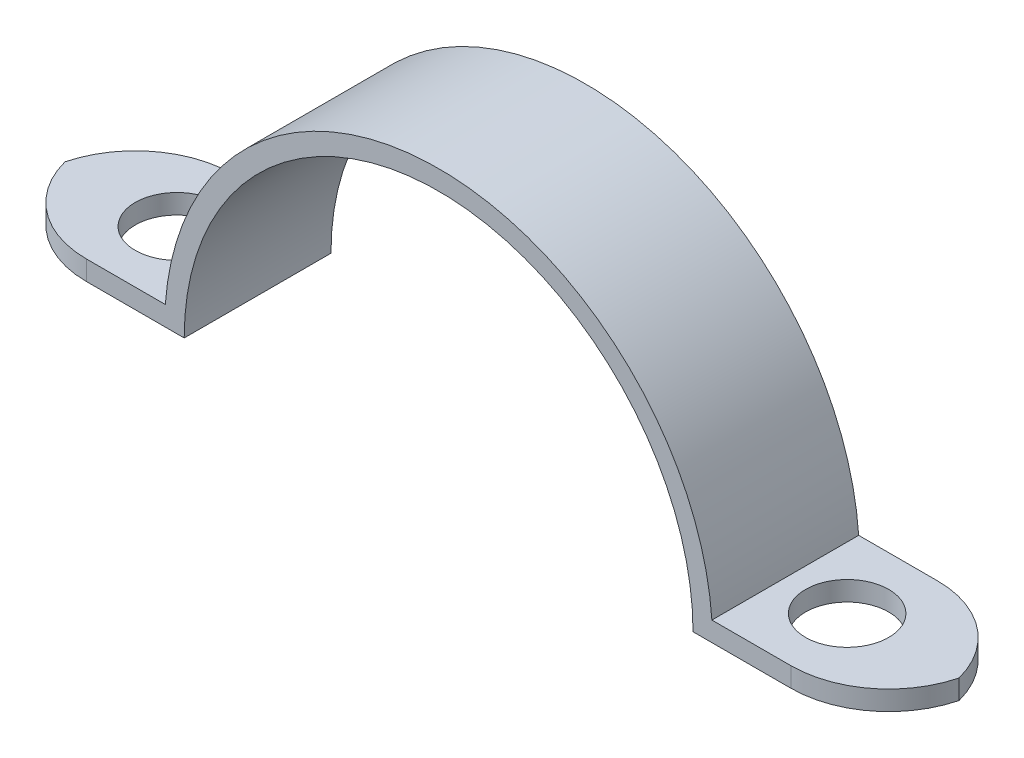
from build123d import *

# Parameters (mm, degrees)
EXTRUDE_THIN2_DEPTH = 15
SKETCH6_R           = 4.25
CUT_EXTRUDE1_DEPTH  = 55.927224579
FILLET1_R           = 10


with BuildPart() as part:
    # Sketch1 → Extrude-Thin2 (new body)
    with BuildSketch(Plane.XY):
        with BuildLine():
            Line((46, 0), (26, 0))
            ThreePointArc((26, 0), (0, 26), (-26, 0))
            Line((-26, 0), (-46, 0))
            Line((-46, 0), (-46, 2))
            Line((-46, 2), (-27.928480088, 2))
            ThreePointArc((-27.928480088, 2), (0, 28), (27.928480088, 2))
            Line((27.928480088, 2), (46, 2))
            Line((46, 2), (46, 0))
        make_face()
    extrude(amount=-EXTRUDE_THIN2_DEPTH)

    # Sketch6 → Cut-Extrude1 (cut, through all)
    with BuildSketch(Plane(origin=(0, 2, 0), x_dir=(1, 0, 0), z_dir=(0, 1, 0))):
        with Locations(Location((-34.25, 7.5, 0), (0, 0, 180))):
            Circle(SKETCH6_R)
        with Locations(Location((34.25, 7.5, 0), (0, 0, 180))):
            Circle(SKETCH6_R)
    extrude(amount=-CUT_EXTRUDE1_DEPTH, mode=Mode.SUBTRACT)

    # Fillet1
    # the kernel refuses this fillet: 10 mm, written as the material it takes off along each edge
    with BuildSketch(Plane(origin=(-46, -25, -15), x_dir=(1, 0, 0), z_dir=(0, 1, 0)), Plane(origin=(46, 27, -15), x_dir=(-1, 0, 0), z_dir=(0, -1, 0))) as fillet1_piece_1:
        with BuildLine():
            CenterArc((FILLET1_R, -FILLET1_R), FILLET1_R, 90, 90)
            Line((0, -FILLET1_R), (0, 0))
            Line((0, 0), (FILLET1_R, 0))
        make_face()
    extrude(amount=52, mode=Mode.SUBTRACT)
    with BuildSketch(Plane(origin=(-46, -25, 0), x_dir=(1, 0, 0), z_dir=(0, 1, 0)), Plane(origin=(46, 27, 0), x_dir=(-1, 0, 0), z_dir=(0, -1, 0))) as fillet1_piece_2:
        with BuildLine():
            CenterArc((FILLET1_R, FILLET1_R), FILLET1_R, 180, 90)
            Line((0, FILLET1_R), (0, 0))
            Line((0, 0), (FILLET1_R, 0))
        make_face()
    extrude(amount=52, mode=Mode.SUBTRACT)


solid = part.part
